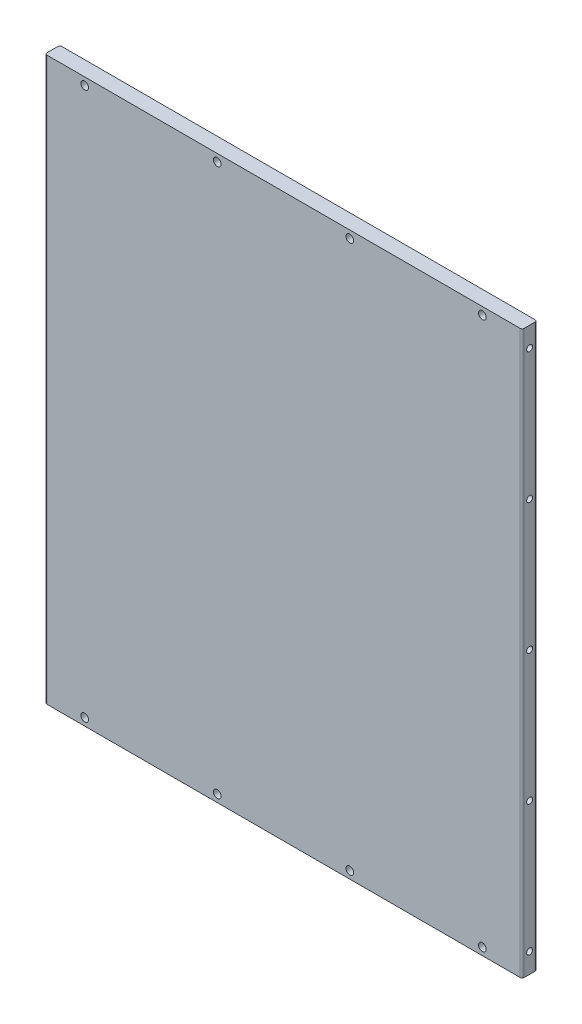
from build123d import *

# Parameters (mm, degrees)
SKETCH1_W                       = 304.8
SKETCH1_H                       = 359.05
BOSS_EXTRUDE1_DEPTH             = 9.525
F_10_24_TAPPED_HOLE1_AT_2_COUNT = 2
F_10_24_TAPPED_HOLE1_AT_2_PITCH = 83.4125
F_10_24_TAPPED_HOLE1_AT_3_COUNT = 2
F_10_24_TAPPED_HOLE1_AT_3_PITCH = 166.825
F_10_24_TAPPED_HOLE1_AT_4_COUNT = 2
F_10_24_TAPPED_HOLE1_AT_4_PITCH = 250.2375
F_10_24_TAPPED_HOLE1_AT_5_COUNT = 2
F_10_24_TAPPED_HOLE1_AT_5_PITCH = 333.65
F_10_0_1935_DIAMETER_HOLE2_D    = 4.9149
FILLET2_R                       = 1.27


with BuildPart() as part:
    # Sketch1 → Boss-Extrude1 (new body)
    with BuildSketch(Plane.XY):
        with Locations((-102.750000669, -245)):
            Rectangle(SKETCH1_W, SKETCH1_H)
    extrude(amount=BOSS_EXTRUDE1_DEPTH)

    # Sketch3 → #10-24 Tapped Hole1 (revolve, cut)
    with BuildSketch(Plane(origin=(49.649999331, -411.825, 4.7625), x_dir=(0, 0, -1), z_dir=(0, 1, 0))):
        Polygon((0, 0), (0, 20.190824014), (1.89865, 19.05), (1.89865, 0), align=None)
    f_10_24_tapped_hole1 = revolve(axis=Axis((55.999999331, -411.825, 4.7625), (-1, 0, 0)), mode=Mode.SUBTRACT)

    # #10-24 Tapped Hole1 at 2: #10-24 Tapped Hole1 ×2
    with Locations(*[(0, i * F_10_24_TAPPED_HOLE1_AT_2_PITCH, 0) for i in range(1, F_10_24_TAPPED_HOLE1_AT_2_COUNT)]):
        add(f_10_24_tapped_hole1, mode=Mode.SUBTRACT)

    # #10-24 Tapped Hole1 at 3: #10-24 Tapped Hole1 ×2
    with Locations(*[(0, i * F_10_24_TAPPED_HOLE1_AT_3_PITCH, 0) for i in range(1, F_10_24_TAPPED_HOLE1_AT_3_COUNT)]):
        add(f_10_24_tapped_hole1, mode=Mode.SUBTRACT)

    # #10-24 Tapped Hole1 at 4: #10-24 Tapped Hole1 ×2
    with Locations(*[(0, i * F_10_24_TAPPED_HOLE1_AT_4_PITCH, 0) for i in range(1, F_10_24_TAPPED_HOLE1_AT_4_COUNT)]):
        add(f_10_24_tapped_hole1, mode=Mode.SUBTRACT)

    # #10-24 Tapped Hole1 at 5: #10-24 Tapped Hole1 ×2
    with Locations(*[(0, i * F_10_24_TAPPED_HOLE1_AT_5_PITCH, 0) for i in range(1, F_10_24_TAPPED_HOLE1_AT_5_COUNT)]):
        add(f_10_24_tapped_hole1, mode=Mode.SUBTRACT)

    # #10 (0.1935) Diameter Hole2 (through all)
    with Locations(Plane.XY.offset(9.525)):
        with Locations((-229.750000669, -70.2375), (-145.083334002, -70.2375), (-60.416667336, -70.2375), (24.249999331, -70.2375), (-229.750000669, -419.7625), (-145.083334002, -419.7625), (-60.416667336, -419.7625), (24.249999331, -419.7625)):
            Hole(F_10_0_1935_DIAMETER_HOLE2_D / 2)

    # Mirror1: #10-24 Tapped Hole1 across plane
    add(f_10_24_tapped_hole1.mirror(Plane(origin=(-102.750000669, 0, 0), x_dir=(0, 0, 1), z_dir=(1, 0, 0))), mode=Mode.SUBTRACT)

    # Mirror1 copy 1 sketch → Mirror1 copy 1 (revolve, cut)
    with BuildSketch(Plane(origin=(-255.150000669, -328.4125, 4.7625), x_dir=(0, 0, -1), z_dir=(0, 1, 0))):
        Polygon((0, 0), (0, -20.190824014), (1.89865, -19.05), (1.89865, 0), align=None)
    revolve(axis=Axis((-261.500000669, -328.4125, 4.7625), (-1, 0, 0)), mode=Mode.SUBTRACT)

    # Mirror1 copy 2 sketch → Mirror1 copy 2 (revolve, cut)
    with BuildSketch(Plane(origin=(-255.150000669, -245, 4.7625), x_dir=(0, 0, -1), z_dir=(0, 1, 0))):
        Polygon((0, 0), (0, -20.190824014), (1.89865, -19.05), (1.89865, 0), align=None)
    revolve(axis=Axis((-261.500000669, -245, 4.7625), (-1, 0, 0)), mode=Mode.SUBTRACT)

    # Mirror1 copy 3 sketch → Mirror1 copy 3 (revolve, cut)
    with BuildSketch(Plane(origin=(-255.150000669, -161.5875, 4.7625), x_dir=(0, 0, -1), z_dir=(0, 1, 0))):
        Polygon((0, 0), (0, -20.190824014), (1.89865, -19.05), (1.89865, 0), align=None)
    revolve(axis=Axis((-261.500000669, -161.5875, 4.7625), (-1, 0, 0)), mode=Mode.SUBTRACT)

    # Mirror1 copy 4 sketch → Mirror1 copy 4 (revolve, cut)
    with BuildSketch(Plane(origin=(-255.150000669, -78.175, 4.7625), x_dir=(0, 0, -1), z_dir=(0, 1, 0))):
        Polygon((0, 0), (0, -20.190824014), (1.89865, -19.05), (1.89865, 0), align=None)
    revolve(axis=Axis((-261.500000669, -78.175, 4.7625), (-1, 0, 0)), mode=Mode.SUBTRACT)

    # Fillet2
    fillet2_edges = [part.edges().sort_by_distance(p)[0] for p in [
        (-255.150000669, -245, 0),
        (-255.150000669, -245, 9.525),
        (49.649999331, -245, 0),
        (49.649999331, -245, 9.525),
    ]]
    fillet(fillet2_edges, radius=FILLET2_R)


solid = part.part
